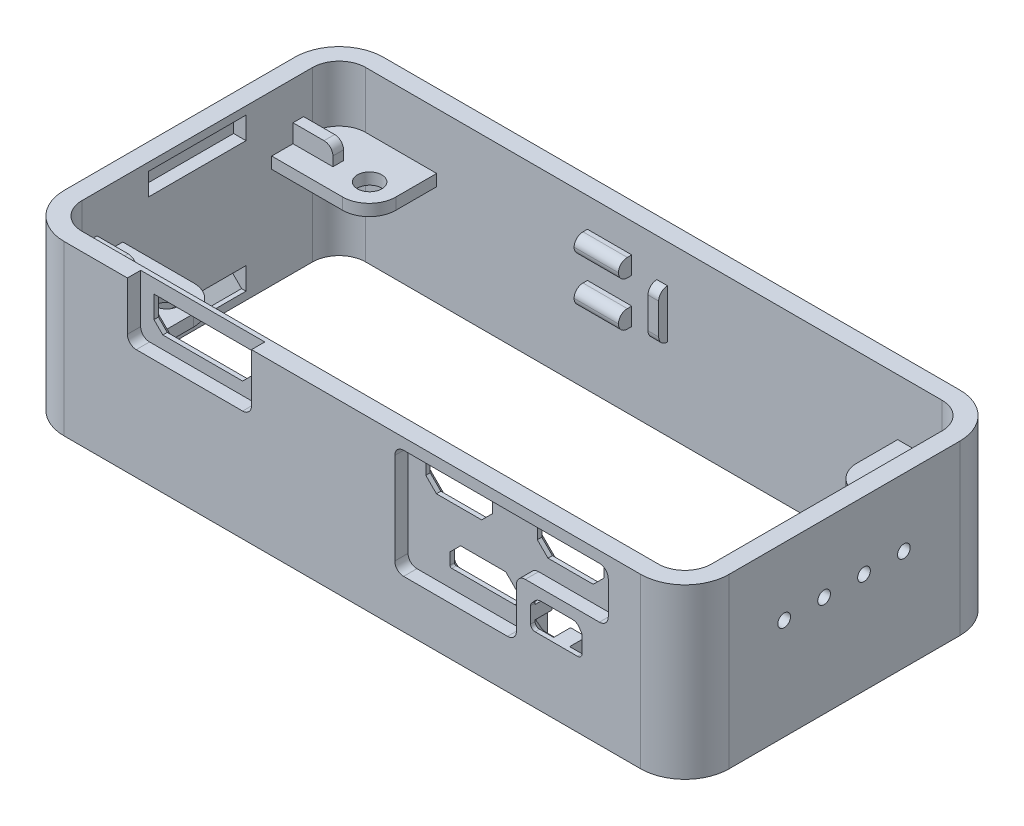
from build123d import *

# Parameters (mm, degrees)
EXTRUDE_1_DEPTH          = 7
EXTRUDE_1_DEPTH_BACK     = 12
CUT_EXTRUDE_2_DEPTH      = 45.635110658
CUT_EXTRUDE_2_DEPTH_BACK = 45.635110658
RIB_START                = -0.65
RIB_1_DEPTH              = 1.3
RIB_2_DEPTH              = 1.3
RIB_3_DEPTH              = 1.3
RIB_4_DEPTH              = 1.3
CUT_EXTRUDE_5_DEPTH      = 40
CUT_EXTRUDE_5_DEPTH_BACK = 40
SKETCH_18_R              = 1.375
SKETCH_41_W              = 14
SKETCH_41_H              = 6.5
CUT_EXTRUDE_14_DEPTH     = 1.5
EXTRUDE_14_DEPTH         = 0.5
CUT_EXTRUDE_18_DEPTH     = 1.5
SKETCH_50_W              = 7.5
SKETCH_50_H              = 2.7
CUT_EXTRUDE_19_DEPTH     = 2.9
SKETCH_51_W              = 5.8
SKETCH_51_H              = 2.8
CUT_EXTRUDE_20_DEPTH     = 2.4
FILLET_15_R              = 1
FILLET_16_R              = 1
FILLET_17_R              = 0.5
SKETCH_52_R              = 0.717792346
CUT_EXTRUDE_21_DEPTH     = 2
SKETCH_53_W              = 1.2
SKETCH_53_H              = 5.5
EXTRUDE_15_DEPTH         = 1
FILLET_20_R              = 1
SKETCH_55_W              = 1.2
SKETCH_55_H              = 5.5
EXTRUDE_17_DEPTH         = 1.4
SKETCH_54_W              = 1.2
SKETCH_54_H              = 5.5
EXTRUDE_18_DEPTH         = 4.5
FILLET_22_R              = 1
CHAMFER_2_SIZE           = 1.2
FILLET_23_R              = 0.2
SKETCH_58_W              = 11
SKETCH_58_H              = 2.5
CUT_EXTRUDE_23_DEPTH     = 1.4
CHAMFER_4_SIZE           = 1
SKETCH_59_W              = 11
SKETCH_59_H              = 2.5
CUT_EXTRUDE_24_DEPTH     = 1.4
CHAMFER_5_SIZE           = 1
SKETCH_60_W              = 7.5
SKETCH_60_H              = 5
CUT_EXTRUDE_25_DEPTH     = 0.5
EXTRUDE_20_DEPTH         = 0.9
EXTRUDE_20_DEPTH_BACK    = 0.5
SKETCH_56_W              = 0.6
SKETCH_56_H              = 1.5
SKETCH_56_W_2            = 1.8
SKETCH_56_H_2            = 0.767886541
SKETCH_56_W_3            = 1.5
SKETCH_56_H_3            = 1.54
CHAMFER_8_SIZE           = 1
SKETCH_63_W              = 1.2
SKETCH_63_H              = 5.5
EXTRUDE_21_DEPTH         = 4.5
FILLET_27_R              = 1
SKETCH_64_W              = 1.2
SKETCH_64_H              = 5.5
EXTRUDE_22_DEPTH         = 1.4
FILLET_28_R              = 1
SKETCH_65_W              = 1.2
SKETCH_65_H              = 5.5
EXTRUDE_23_DEPTH         = 0.9
CHAMFER_9_SIZE           = 0.5
FILLET_29_R              = 1
SKETCH_66_W              = 15
SKETCH_66_H              = 5
CUT_EXTRUDE_26_DEPTH     = 1.5
CHAMFER_10_SIZE          = 1
SKETCH_67_W              = 11
SKETCH_67_H              = 2.5
CUT_EXTRUDE_27_DEPTH     = 1.5
CHAMFER_11_SIZE          = 1
SKETCH_70_W              = 5
SKETCH_70_H              = 1.2
EXTRUDE_24_DEPTH         = 1.5
FILLET_31_R              = 1
SKETCH_71_W              = 5
SKETCH_71_H              = 2
EXTRUDE_25_DEPTH         = 1.5
FILLET_32_R              = 1
SKETCH_42_W              = 11
SKETCH_42_H              = 3.5
CUT_EXTRUDE_15_DEPTH     = 2.4
CUT_EXTRUDE_16_DEPTH     = 2.4
FILLET_33_R              = 1
SKETCH_74_W              = 16
SKETCH_74_H              = 7.4
EXTRUDE_26_DEPTH         = 0.5
CUT_EXTRUDE_29_REACH     = 56.445
SKETCH_46_W              = 11
SKETCH_46_H              = 3.5
CHAMFER_13_SIZE          = 1
FILLET_34_R              = 1
CHAMFER_14_SIZE          = 0.5
SKETCH_76_W              = 65
SKETCH_76_H              = 0.5
CUT_EXTRUDE_30_DEPTH     = 1.1
FILLET_35_R              = 1
FILLET_38_R              = 1.5


# Read off the part's stored shape, not the designer's step: 筋1, 筋2, 筋3, 筋4
# Some blends are built 0.0001 mm under size
with BuildPart() as part:
    # case 2 → 凸台-拉伸1 (new, two sides: drawn at the far end of the back side and taken through both)
    with BuildSketch(Plane(origin=(0, 0, 0), x_dir=(1, 0, 0), z_dir=(0, 1, 0)).offset(-EXTRUDE_1_DEPTH_BACK)):
        with BuildLine():
            Line((-34.042196447, 18), (30.957803553, 18))
            ThreePointArc((30.957803553, 18), (34.493337459, 16.535533906), (35.957803553, 13))
            Line((35.957803553, 13), (35.957803553, -13))
            ThreePointArc((35.957803553, -13), (34.493337459, -16.535533906), (30.957803553, -18))
            Line((30.957803553, -18), (-34.042196447, -18))
            ThreePointArc((-34.042196447, -18), (-37.577730353, -16.535533906), (-39.042196447, -13))
            Line((-39.042196447, -13), (-39.042196447, 13))
            ThreePointArc((-39.042196447, 13), (-37.577730353, 16.535533906), (-34.042196447, 18))
        make_face()
    extrude(amount=EXTRUDE_1_DEPTH + EXTRUDE_1_DEPTH_BACK)

    # 草图13 → 切除-拉伸2 (cut, two sides: drawn at the far end of the back side and taken through both)
    with BuildSketch(Plane(origin=(0, 0, 0), x_dir=(1, 0, 0), z_dir=(0, 1, 0)).offset(-CUT_EXTRUDE_2_DEPTH_BACK)):
        with BuildLine():
            Line((-34.042196447, -16), (30.957803553, -16))
            ThreePointArc((30.957803553, -16), (33.079123896, -15.121320344), (33.957803553, -13))
            Line((33.957803553, -13), (33.957803553, 13))
            ThreePointArc((33.957803553, 13), (33.079123896, 15.121320344), (30.957803553, 16))
            Line((30.957803553, 16), (-34.042196447, 16))
            ThreePointArc((-34.042196447, 16), (-36.163516791, 15.121320344), (-37.042196447, 13))
            Line((-37.042196447, 13), (-37.042196447, -13))
            ThreePointArc((-37.042196447, -13), (-36.163516791, -15.121320344), (-34.042196447, -16))
        make_face()
    extrude(amount=CUT_EXTRUDE_2_DEPTH + CUT_EXTRUDE_2_DEPTH_BACK, mode=Mode.SUBTRACT)

    # 筋1 outline → 筋1 (add)
    with BuildSketch(Plane(origin=(0, 0, 0), x_dir=(1, 0, 0), z_dir=(0, 1, 0)).offset(RIB_START)):
        with BuildLine():
            Line((-37.042196447, 8.4), (-29.042196447, 8.4))
            ThreePointArc((-29.042196447, 8.4), (-26.920876103, 9.278679657), (-26.042196447, 11.4))
            Line((-26.042196447, 11.4), (-26.042196447, 16))
            Line((-26.042196447, 16), (-34.042196447, 16))
            ThreePointArc((-34.042196447, 16), (-36.163516791, 15.121320344), (-37.042196447, 13))
            Line((-37.042196447, 13), (-37.042196447, 8.4))
        make_face()
    extrude(amount=RIB_1_DEPTH)

    # 筋2 outline → 筋2 (add)
    with BuildSketch(Plane(origin=(0, 0, 0), x_dir=(1, 0, 0), z_dir=(0, 1, 0)).offset(RIB_START)):
        with BuildLine():
            Line((-34.042196447, -16), (-26.042196447, -16))
            Line((-26.042196447, -16), (-26.042196447, -11.4))
            ThreePointArc((-26.042196447, -11.4), (-26.920876103, -9.278679657), (-29.042196447, -8.4))
            Line((-29.042196447, -8.4), (-37.042196447, -8.4))
            Line((-37.042196447, -8.4), (-37.042196447, -13))
            ThreePointArc((-37.042196447, -13), (-36.163516791, -15.121320344), (-34.042196447, -16))
        make_face()
    extrude(amount=RIB_2_DEPTH)

    # 筋3 outline → 筋3 (add)
    with BuildSketch(Plane(origin=(0, 0, 0), x_dir=(1, 0, 0), z_dir=(0, 1, 0)).offset(RIB_START)):
        with BuildLine():
            ThreePointArc((25.957803553, 11.4), (26.836483209, 9.278679656), (28.957803553, 8.4))
            Line((28.957803553, 8.4), (33.957803553, 8.4))
            Line((33.957803553, 8.4), (33.957803553, 13))
            ThreePointArc((33.957803553, 13), (33.079123897, 15.121320343), (30.957803553, 16))
            Line((30.957803553, 16), (25.957803553, 16))
            Line((25.957803553, 16), (25.957803553, 11.4))
        make_face()
    extrude(amount=RIB_3_DEPTH)

    # 筋4 outline → 筋4 (add)
    with BuildSketch(Plane(origin=(0, 0, 0), x_dir=(1, 0, 0), z_dir=(0, 1, 0)).offset(RIB_START)):
        with BuildLine():
            Line((33.957803553, -13), (33.957803553, -8.4))
            Line((33.957803553, -8.4), (28.957803553, -8.4))
            ThreePointArc((28.957803553, -8.4), (26.836483209, -9.278679656), (25.957803553, -11.4))
            Line((25.957803553, -11.4), (25.957803553, -16))
            Line((25.957803553, -16), (30.957803553, -16))
            ThreePointArc((30.957803553, -16), (33.079123897, -15.121320343), (33.957803553, -13))
        make_face()
    extrude(amount=RIB_4_DEPTH)

    # 草图18 → 切除-拉伸5 (cut, two sides: drawn at the far end of the back side and taken through both)
    with BuildSketch(Plane(origin=(0, 0, 0), x_dir=(1, 0, 0), z_dir=(0, 1, 0)).offset(-CUT_EXTRUDE_5_DEPTH_BACK)):
        with Locations(Location((-29, 11.4, 0), (0, 0, 270))):
            Circle(SKETCH_18_R)
        with Locations(Location((-29, -11.5, 0), (0, 0, 270))):
            Circle(SKETCH_18_R)
        with Locations(Location((29, 11.4, 0), (0, 0, 270))):
            Circle(SKETCH_18_R)
        with Locations(Location((29, -11.5, 0), (0, 0, 270))):
            Circle(SKETCH_18_R)
    extrude(amount=CUT_EXTRUDE_5_DEPTH + CUT_EXTRUDE_5_DEPTH_BACK, mode=Mode.SUBTRACT)

    # 草图41 → 切除-拉伸14 (cut)
    with BuildSketch(Plane.XY.offset(18)):
        with Locations((-19.922149827, 3.75)):
            Rectangle(SKETCH_41_W, SKETCH_41_H)
    extrude(amount=-CUT_EXTRUDE_14_DEPTH, mode=Mode.SUBTRACT)

    # 草图48 → 凸台-拉伸14 (add)
    with BuildSketch(Plane(origin=(0, 0, 16), x_dir=(-1, 0, 0), z_dir=(0, 0, -1))):
        Polygon((-2.234862183, -7.567886541), (-2.234862183, 6.748192542), (-28.313738428, 6.748192542), (-28.313738428, -1), (-17.957803553, -1), (-17.957803553, -7.567886541), align=None)
    extrude(amount=EXTRUDE_14_DEPTH)

    # 草图49 → 切除-拉伸18 (cut)
    with BuildSketch(Plane.XY.offset(18)):
        Polygon((27.313738428, 5.748192542), (27.313738428, 0), (16.957803553, 0), (16.957803553, -6.567886541), (3.234862183, -6.567886541), (3.234862183, 5.748192542), align=None)
    extrude(amount=-CUT_EXTRUDE_18_DEPTH, mode=Mode.SUBTRACT)

    # 草图50 → 切除-拉伸19 (cut)
    with BuildSketch(Plane.XY.offset(18)):
        with Locations((21.563738428, 3.198192542)):
            Rectangle(SKETCH_50_W, SKETCH_50_H)
        with Locations((11.707803553, -3.217886541)):
            Rectangle(SKETCH_50_W, SKETCH_50_H)
        with Locations((8.984862183, 3.198192542)):
            Rectangle(SKETCH_50_W, SKETCH_50_H)
    extrude(amount=-CUT_EXTRUDE_19_DEPTH, mode=Mode.SUBTRACT)

    # 草图51 → 切除-拉伸20 (cut)
    with BuildSketch(Plane.XY.offset(18)):
        with Locations((21.457803553, -3.167886541)):
            Rectangle(SKETCH_51_W, SKETCH_51_H)
    extrude(amount=-CUT_EXTRUDE_20_DEPTH, mode=Mode.SUBTRACT)

    # 圆角15
    fillet_15_edges = [part.edges().sort_by_distance(p)[0] for p in [
        (3.234862183, 5.748192542, 17.25),
        (27.313738428, 5.748192542, 17.25),
        (27.313738428, 0, 17.25),
        (16.957803553, 0, 17.25),
        (16.957803553, -6.567886541, 17.25),
        (3.234862183, -6.567886541, 17.25),
    ]]
    fillet(fillet_15_edges, radius=FILLET_15_R)

    # 圆角16
    # the kernel refuses this fillet: 1 mm, written as the material it takes off along each edge
    with BuildSketch(Plane(origin=(2.234862183, -7.567886541, 16), x_dir=(0, 1, 0), z_dir=(0, 0, -1)), Plane(origin=(17.957803553, -7.567886541, 16), x_dir=(-1, 0, 0), z_dir=(0, 0, -1))) as fillet_16_piece_1:
        with BuildLine():
            CenterArc((FILLET_16_R, FILLET_16_R), FILLET_16_R, 180, 90)
            Line((0, FILLET_16_R), (-FILLET_16_R * 0.02, FILLET_16_R))
            Line((-FILLET_16_R * 0.02, FILLET_16_R), (-FILLET_16_R * 0.02, -FILLET_16_R * 0.02))
            Line((-FILLET_16_R * 0.02, -FILLET_16_R * 0.02), (FILLET_16_R, -FILLET_16_R * 0.02))
            Line((FILLET_16_R, -FILLET_16_R * 0.02), (FILLET_16_R, 0))
        make_face()
    extrude(amount=3, mode=Mode.SUBTRACT)
    with BuildSketch(Plane(origin=(28.313738428, -1, 16), x_dir=(0, 1, 0), z_dir=(0, 0, -1))) as fillet_16_piece_2:
        with BuildLine():
            CenterArc((1, -0.759934208), FILLET_16_R, 130.541601874, 49.458398126)
            Line((0, -0.759934208), (-0.02, -0.759934208))
            Line((-0.02, -0.759934208), (-0.02, 0))
            Line((-0.02, 0), (0, 0.02))
            ThreePointArc((0, 0.02), (0.175, 0.02), (0.337, 0.015198684))
            Line((0.337, 0.015198684), (0.35, 0))
        make_face()
    extrude(amount=2.399835519, mode=Mode.SUBTRACT)

    # 圆角17
    fillet_17_edges = [part.edges().sort_by_distance(p)[0] for p in [
        (18.557803553, -1.767886541, 17),
        (24.357803553, -1.767886541, 17),
        (24.357803553, -4.567886541, 17),
        (18.557803553, -4.567886541, 17),
    ]]
    fillet(fillet_17_edges, radius=FILLET_17_R)

    # 草图52 → 切除-拉伸21 (cut)
    with BuildSketch(Plane(origin=(35.957803553, 0, 0), x_dir=(0, 0, -1), z_dir=(1, 0, 0))):
        with Locations((-6.8, -0.597891307)):
            Circle(SKETCH_52_R)
        with Locations((-2.3, -0.597891307)):
            Circle(SKETCH_52_R)
        with Locations((2.2, -0.597891307)):
            Circle(SKETCH_52_R)
        with Locations((6.7, -0.597891307)):
            Circle(SKETCH_52_R)
    extrude(amount=-CUT_EXTRUDE_21_DEPTH, mode=Mode.SUBTRACT)

    # 草图53 → 凸台-拉伸15 (add)
    with BuildSketch(Plane.XY.offset(-16)):
        with Locations((-0.6, -0.05)):
            Rectangle(SKETCH_53_W, SKETCH_53_H)
    extrude(amount=EXTRUDE_15_DEPTH)

    # 圆角20
    fillet_20_edges = [part.edges().sort_by_distance(p)[0] for p in [
        (-0.6, -2.8, -15),
        (-0.6, 2.7, -15),
    ]]
    fillet(fillet_20_edges, radius=FILLET_20_R - 0.0001)  # a hair under: the kernel refuses the full size

    # 草图55 → 凸台-拉伸17 (add)
    with BuildSketch(Plane.ZY.offset(-33.957803553)):
        with Locations((-11.4, -0.05)):
            Rectangle(SKETCH_55_W, SKETCH_55_H)
    extrude(amount=EXTRUDE_17_DEPTH)

    # 草图54 → 凸台-拉伸18 (add)
    with BuildSketch(Plane(origin=(-37.042196447, 0, 0), x_dir=(0, 0, -1), z_dir=(1, 0, 0))):
        with Locations((11.4, -0.05)):
            Rectangle(SKETCH_54_W, SKETCH_54_H)
    extrude(amount=EXTRUDE_18_DEPTH)

    # 圆角22
    fillet_22_edges = [part.edges().sort_by_distance(p)[0] for p in [
        (32.557803553, -2.8, -11.4),
        (32.557803553, 2.7, -11.4),
        (-32.542196447, -2.8, -11.4),
        (-32.542196447, 2.7, -11.4),
    ]]
    fillet(fillet_22_edges, radius=FILLET_22_R)

    # 倒角2
    chamfer_2_edges = [part.edges().sort_by_distance(p)[0] for p in [
        (25.313738428, 1.848192542, 16),
        (17.813738428, 1.848192542, 16),
        (7.957803553, -1.867886541, 16),
        (15.457803553, -1.867886541, 16),
        (5.234862183, 1.848192542, 16),
        (12.734862183, 1.848192542, 16),
    ]]
    chamfer(chamfer_2_edges, length=CHAMFER_2_SIZE)

    # 圆角23
    fillet_23_edges = [part.edges().sort_by_distance(p)[0] for p in [
        (17.813738428, 4.548192542, 16),
        (25.313738428, 4.548192542, 16),
        (15.457803553, -4.567886541, 16),
        (7.957803553, -4.567886541, 16),
        (5.234862183, 4.548192542, 16),
        (12.734862183, 4.548192542, 16),
    ]]
    fillet(fillet_23_edges, radius=FILLET_23_R)

    # 草图58 → 切除-拉伸23 (cut)
    with BuildSketch(Plane.ZY.offset(-33.957803553)):
        with Locations((0, -9.85)):
            Rectangle(SKETCH_58_W, SKETCH_58_H)
    extrude(amount=-CUT_EXTRUDE_23_DEPTH, mode=Mode.SUBTRACT)

    # 倒角4
    chamfer_4_edges = [part.edges().sort_by_distance(p)[0] for p in [
        (35.357803553, -11.1, 0),
    ]]
    chamfer(chamfer_4_edges, length=CHAMFER_4_SIZE)

    # 草图59 → 切除-拉伸24 (cut)
    with BuildSketch(Plane(origin=(-37.042196447, 0, 0), x_dir=(0, 0, -1), z_dir=(1, 0, 0))):
        with Locations((0, 4.85)):
            Rectangle(SKETCH_59_W, SKETCH_59_H)
    extrude(amount=-CUT_EXTRUDE_24_DEPTH, mode=Mode.SUBTRACT)

    # 倒角5
    chamfer_5_edges = [part.edges().sort_by_distance(p)[0] for p in [
        (-38.442196447, 6.1, 0),
    ]]
    chamfer(chamfer_5_edges, length=CHAMFER_5_SIZE)

    # 草图60 → 切除-拉伸25 (cut)
    with BuildSketch(Plane(origin=(0, 0, 16), x_dir=(-1, 0, 0), z_dir=(0, 0, -1))):
        with Locations((-21.707803553, -3.5)):
            Rectangle(SKETCH_60_W, SKETCH_60_H)
    extrude(amount=-CUT_EXTRUDE_25_DEPTH, mode=Mode.SUBTRACT)

    # 草图56 → 凸台-拉伸20 (add, two sides: drawn at the far end of the back side and taken through both)
    with BuildSketch(Plane(origin=(0, 0, 16), x_dir=(-1, 0, 0), z_dir=(0, 0, -1)).offset(-EXTRUDE_20_DEPTH_BACK)):
        with Locations((-18.257803553, -3.15173139)):
            Rectangle(SKETCH_56_W, SKETCH_56_H)
        with Locations((-21.557803553, -1.383943271)):
            Rectangle(SKETCH_56_W_2, SKETCH_56_H_2)
        with Locations((-25.107803553, -3.15173139)):
            Rectangle(SKETCH_56_W_3, SKETCH_56_H)
        with Locations((-21.557803553, -5.337886541)):
            Rectangle(SKETCH_56_W_2, SKETCH_56_H_3)
    extrude(amount=EXTRUDE_20_DEPTH + EXTRUDE_20_DEPTH_BACK)

    # 倒角8
    # the kernel refuses this chamfer: 1 mm, written as the material it takes off along each edge
    with BuildSketch(Plane(origin=(19.057803553, -2.267886541, 16.5), x_dir=(-1, 0, 0), z_dir=(0, -1, 0))) as chamfer_8_piece_1_section:
        Polygon((0.5, -CHAMFER_8_SIZE), (0.5 + CHAMFER_8_SIZE, 0), (0.5, 0), align=None)
    chamfer_8_piece_1 = revolve(axis=Axis((19.057803553, -2.267886541, 16.5), (0, 0, -1)), revolution_arc=90, mode=Mode.PRIVATE)
    chamfer_8_piece_1 = split(chamfer_8_piece_1, bisect_by=Plane(origin=(17.957803553, -1.691525434, 16.812800838), z_dir=(1, 0, 0)), keep=Keep.TOP, mode=Mode.PRIVATE)
    chamfer_8_piece_1 = split(chamfer_8_piece_1, bisect_by=Plane(origin=(18.527910829, -1, 16.812800838), z_dir=(0, -1, 0)), keep=Keep.TOP, mode=Mode.PRIVATE)
    add(chamfer_8_piece_1, mode=Mode.SUBTRACT)
    with BuildSketch(Plane(origin=(24.357803553, -2.267886541, 16.5), x_dir=(-0.027495876610585647, 0, 0.9996219169112968), z_dir=(0, -1, 0))) as chamfer_8_piece_2:
        Polygon((CHAMFER_8_SIZE * 0.999621916911, -CHAMFER_8_SIZE * 0.0274958766106), (-CHAMFER_8_SIZE * 0.0274958766106, -CHAMFER_8_SIZE * 0.999621916911), (0, 0), align=None)
    extrude(amount=0.133844849, mode=Mode.SUBTRACT)
    with BuildSketch(Plane(origin=(23.857803553, -4.067886541, 16.5), x_dir=(1, 0, 0), z_dir=(0, 1, 0))) as chamfer_8_piece_3:
        Polygon((0.5, -CHAMFER_8_SIZE), (0.5 + CHAMFER_8_SIZE, 0), (0.5, 0), align=None)
    revolve(axis=Axis((23.857803553, -4.067886541, 16.5), (0, 0, -1)), revolution_arc=90, mode=Mode.SUBTRACT)
    with BuildSketch(Plane(origin=(23.857803553, -4.567886541, 16.5), x_dir=(0, 0.02749587661058651, 0.9996219169112968), z_dir=(-1, 0, 0))) as chamfer_8_piece_4:
        Polygon((CHAMFER_8_SIZE * 0.999621916911, -CHAMFER_8_SIZE * 0.0274958766106), (-CHAMFER_8_SIZE * 0.0274958766106, -CHAMFER_8_SIZE * 0.999621916911), (0, 0), align=None)
    extrude(amount=1.4, mode=Mode.SUBTRACT)
    with BuildSketch(Plane(origin=(23.857803553, -4.567886541, 16.5), x_dir=(0, 0.02749587661058651, 0.9996219169112968), z_dir=(-1, 0, 0))) as chamfer_8_piece_5_section:
        Polygon((CHAMFER_8_SIZE * 0.999621916911, -CHAMFER_8_SIZE * 0.0274958766106), (-CHAMFER_8_SIZE * 0.0274958766106, -CHAMFER_8_SIZE * 0.999621916911), (0, 0), align=None)
    chamfer_8_piece_5 = extrude(amount=3.971682988, mode=Mode.PRIVATE)
    chamfer_8_piece_5 = split(chamfer_8_piece_5, bisect_by=Plane(origin=(20.657803553, -4.897680168, 16.829793627), z_dir=(-1, 0, 0)), keep=Keep.TOP, mode=Mode.PRIVATE)
    add(chamfer_8_piece_5, mode=Mode.SUBTRACT)
    with BuildSketch(Plane(origin=(19.057803553, -4.067886541, 16.5), x_dir=(0, -1, 0), z_dir=(1, 0, 0))) as chamfer_8_piece_6_section:
        Polygon((0.5, -CHAMFER_8_SIZE), (0.5 + CHAMFER_8_SIZE, 0), (0.5, 0), align=None)
    chamfer_8_piece_6 = revolve(axis=Axis((19.057803553, -4.067886541, 16.5), (0, 0, -1)), revolution_arc=90, mode=Mode.PRIVATE)
    chamfer_8_piece_6 = split(chamfer_8_piece_6, bisect_by=Plane(origin=(17.957803553, -4.664386094, 16.805594695), z_dir=(1, 0, 0)), keep=Keep.TOP, mode=Mode.PRIVATE)
    add(chamfer_8_piece_6, mode=Mode.SUBTRACT)
    with BuildSketch(Plane(origin=(18.557803553, -4.067886541, 16.5), x_dir=(0.027495876610585647, 0, 0.9996219169112968), z_dir=(0, 1, 0))) as chamfer_8_piece_7_section:
        Polygon((CHAMFER_8_SIZE * 0.999621916911, -CHAMFER_8_SIZE * 0.0274958766106), (-CHAMFER_8_SIZE * 0.0274958766106, -CHAMFER_8_SIZE * 0.999621916911), (0, 0), align=None)
    chamfer_8_piece_7 = extrude(amount=0.166155151, mode=Mode.PRIVATE)
    chamfer_8_piece_7 = split(chamfer_8_piece_7, bisect_by=Plane(origin=(17.957803553, -3.984808965, 16.87500946), z_dir=(1, 0, 0)), keep=Keep.TOP, mode=Mode.PRIVATE)
    add(chamfer_8_piece_7, mode=Mode.SUBTRACT)
    with BuildSketch(Plane(origin=(19.057803553, -1.767886541, 16.5), x_dir=(0, -0.02749587661058651, 0.9996219169112968), z_dir=(1, 0, 0))) as chamfer_8_piece_8_section:
        Polygon((CHAMFER_8_SIZE * 0.999621916911, -CHAMFER_8_SIZE * 0.0274958766106), (-CHAMFER_8_SIZE * 0.0274958766106, -CHAMFER_8_SIZE * 0.999621916911), (0, 0), align=None)
    chamfer_8_piece_8 = extrude(amount=1.6, mode=Mode.PRIVATE)
    chamfer_8_piece_8 = split(chamfer_8_piece_8, bisect_by=Plane(origin=(19.857803553, -1, 16.849634221), z_dir=(0, -1, 0)), keep=Keep.TOP, mode=Mode.PRIVATE)
    add(chamfer_8_piece_8, mode=Mode.SUBTRACT)
    with BuildSketch(Plane(origin=(19.057803553, -1.767886541, 16.5), x_dir=(0, -0.02749587661058651, 0.9996219169112968), z_dir=(1, 0, 0))) as chamfer_8_piece_9_section:
        Polygon((CHAMFER_8_SIZE * 0.999621916911, -CHAMFER_8_SIZE * 0.0274958766106), (-CHAMFER_8_SIZE * 0.0274958766106, -CHAMFER_8_SIZE * 0.999621916911), (0, 0), align=None)
    chamfer_8_piece_9 = extrude(amount=4.171682988, mode=Mode.PRIVATE)
    chamfer_8_piece_9 = split(chamfer_8_piece_9, bisect_by=Plane(origin=(22.843645047, -1, 16.849634221), z_dir=(0, -1, 0)), keep=Keep.TOP, mode=Mode.PRIVATE)
    chamfer_8_piece_9 = split(chamfer_8_piece_9, bisect_by=Plane(origin=(22.457803553, -1.47595166, 16.849634221), z_dir=(1, 0, 0)), keep=Keep.TOP, mode=Mode.PRIVATE)
    add(chamfer_8_piece_9, mode=Mode.SUBTRACT)
    with BuildSketch(Plane(origin=(23.857803553, -2.267886541, 16.5), x_dir=(0, 1, 0), z_dir=(-1, 0, 0))) as chamfer_8_piece_10_section:
        Polygon((0.5, -CHAMFER_8_SIZE), (0.5 + CHAMFER_8_SIZE, 0), (0.5, 0), align=None)
    chamfer_8_piece_10 = revolve(axis=Axis((23.857803553, -2.267886541, 16.5), (0, 0, -1)), revolution_arc=90, mode=Mode.PRIVATE)
    chamfer_8_piece_10 = split(chamfer_8_piece_10, bisect_by=Plane(origin=(24.442211252, -1, 16.795113349), z_dir=(0, -1, 0)), keep=Keep.TOP, mode=Mode.PRIVATE)
    add(chamfer_8_piece_10, mode=Mode.SUBTRACT)
    with BuildSketch(Plane(origin=(19.886120565, -1.767886541, 16.5), x_dir=(0, -0.027495876610586296, 0.9996219169112968), z_dir=(1, 0, 0))) as chamfer_8_piece_11_section:
        Polygon((CHAMFER_8_SIZE * 0.999621916911, -CHAMFER_8_SIZE * 0.0274958766106), (-CHAMFER_8_SIZE * 0.0274958766106, -CHAMFER_8_SIZE * 0.999621916911), (0, 0), align=None)
    chamfer_8_piece_11 = extrude(amount=3.971682988, mode=Mode.PRIVATE)
    chamfer_8_piece_11 = split(chamfer_8_piece_11, bisect_by=Plane(origin=(20.271962059, -1, 16.849634221), z_dir=(0, -1, 0)), keep=Keep.TOP, mode=Mode.PRIVATE)
    chamfer_8_piece_11 = split(chamfer_8_piece_11, bisect_by=Plane(origin=(20.657803553, -1.47595166, 16.849634221), z_dir=(-1, 0, 0)), keep=Keep.TOP, mode=Mode.PRIVATE)
    add(chamfer_8_piece_11, mode=Mode.SUBTRACT)
    with BuildSketch(Plane(origin=(22.457803553, -1.767886541, 16.5), x_dir=(0, -0.02749587661058651, 0.9996219169112968), z_dir=(1, 0, 0))) as chamfer_8_piece_12_section:
        Polygon((CHAMFER_8_SIZE * 0.999621916911, -CHAMFER_8_SIZE * 0.0274958766106), (-CHAMFER_8_SIZE * 0.0274958766106, -CHAMFER_8_SIZE * 0.999621916911), (0, 0), align=None)
    chamfer_8_piece_12 = extrude(amount=1.4, mode=Mode.PRIVATE)
    chamfer_8_piece_12 = split(chamfer_8_piece_12, bisect_by=Plane(origin=(23.157803553, -1, 16.849634221), z_dir=(0, -1, 0)), keep=Keep.TOP, mode=Mode.PRIVATE)
    add(chamfer_8_piece_12, mode=Mode.SUBTRACT)
    with BuildSketch(Plane(origin=(18.557803553, -2.40173139, 16.5), x_dir=(0.027495876610585647, 0, 0.9996219169112968), z_dir=(0, 1, 0))) as chamfer_8_piece_13_section:
        Polygon((CHAMFER_8_SIZE * 0.999621916911, -CHAMFER_8_SIZE * 0.0274958766106), (-CHAMFER_8_SIZE * 0.0274958766106, -CHAMFER_8_SIZE * 0.999621916911), (0, 0), align=None)
    chamfer_8_piece_13 = extrude(amount=0.133844849, mode=Mode.PRIVATE)
    chamfer_8_piece_13 = split(chamfer_8_piece_13, bisect_by=Plane(origin=(17.957803553, -2.334808965, 16.87500946), z_dir=(1, 0, 0)), keep=Keep.TOP, mode=Mode.PRIVATE)
    add(chamfer_8_piece_13, mode=Mode.SUBTRACT)
    with BuildSketch(Plane(origin=(24.357803553, -3.90173139, 16.5), x_dir=(-0.027495876610585647, 0, 0.9996219169112968), z_dir=(0, -1, 0))) as chamfer_8_piece_14:
        Polygon((CHAMFER_8_SIZE * 0.999621916911, -CHAMFER_8_SIZE * 0.0274958766106), (-CHAMFER_8_SIZE * 0.0274958766106, -CHAMFER_8_SIZE * 0.999621916911), (0, 0), align=None)
    extrude(amount=0.166155151, mode=Mode.SUBTRACT)
    with BuildSketch(Plane(origin=(23.229486541, -4.567886541, 16.5), x_dir=(0, 0.02749587661058651, 0.9996219169112968), z_dir=(-1, 0, 0))) as chamfer_8_piece_15_section:
        Polygon((CHAMFER_8_SIZE * 0.999621916911, -CHAMFER_8_SIZE * 0.0274958766106), (-CHAMFER_8_SIZE * 0.0274958766106, -CHAMFER_8_SIZE * 0.999621916911), (0, 0), align=None)
    chamfer_8_piece_15 = extrude(amount=4.171682988, mode=Mode.PRIVATE)
    chamfer_8_piece_15 = split(chamfer_8_piece_15, bisect_by=Plane(origin=(22.457803553, -4.897680168, 16.829793627), z_dir=(1, 0, 0)), keep=Keep.TOP, mode=Mode.PRIVATE)
    add(chamfer_8_piece_15, mode=Mode.SUBTRACT)
    with BuildSketch(Plane(origin=(20.657803553, -4.567886541, 16.5), x_dir=(0, 0.02749587661058651, 0.9996219169112968), z_dir=(-1, 0, 0))) as chamfer_8_piece_16:
        Polygon((CHAMFER_8_SIZE * 0.999621916911, -CHAMFER_8_SIZE * 0.0274958766106), (-CHAMFER_8_SIZE * 0.0274958766106, -CHAMFER_8_SIZE * 0.999621916911), (0, 0), align=None)
    extrude(amount=1.6, mode=Mode.SUBTRACT)

    # 草图63 → 凸台-拉伸21 (add)
    with BuildSketch(Plane(origin=(-37.042196447, 0, 0), x_dir=(0, 0, -1), z_dir=(1, 0, 0))):
        with Locations((-11.9, -0.05)):
            Rectangle(SKETCH_63_W, SKETCH_63_H)
    extrude(amount=EXTRUDE_21_DEPTH)

    # 圆角27
    fillet_27_edges = [part.edges().sort_by_distance(p)[0] for p in [
        (-32.542196447, -2.8, 11.9),
        (-32.542196447, 2.7, 11.9),
    ]]
    fillet(fillet_27_edges, radius=FILLET_27_R)

    # 草图64 → 凸台-拉伸22 (add)
    with BuildSketch(Plane.ZY.offset(-33.957803553)):
        with Locations((11.9, -0.05)):
            Rectangle(SKETCH_64_W, SKETCH_64_H)
    extrude(amount=EXTRUDE_22_DEPTH)

    # 圆角28
    fillet_28_edges = [part.edges().sort_by_distance(p)[0] for p in [
        (32.557803553, -2.8, 11.9),
        (32.557803553, 2.7, 11.9),
    ]]
    fillet(fillet_28_edges, radius=FILLET_28_R)

    # 草图65 → 凸台-拉伸23 (add)
    with BuildSketch(Plane(origin=(0, 0, 16), x_dir=(-1, 0, 0), z_dir=(0, 0, -1))):
        with Locations((0.6, -0.05)):
            Rectangle(SKETCH_65_W, SKETCH_65_H)
    extrude(amount=EXTRUDE_23_DEPTH)

    # 倒角9
    chamfer_9_edges = [part.edges().sort_by_distance(p)[0] for p in [
        (21.557803553, -1.767886541, 15.1),
        (18.557803553, -3.15173139, 15.1),
        (24.357803553, -3.15173139, 15.1),
        (21.557803553, -4.567886541, 15.1),
    ]]
    chamfer(chamfer_9_edges, length=CHAMFER_9_SIZE)

    # 圆角29
    # the kernel refuses this fillet: 1 mm, written as the material it takes off along each edge
    with BuildSketch(Plane(origin=(0, -2.8, 15.1), x_dir=(0, 0, 1), z_dir=(-1, 0, 0)), Plane(origin=(-3.687468593, 2.7, 15.1), x_dir=(0, 0, 1), z_dir=(1, 0, 0))) as fillet_29_piece_1:
        with BuildLine():
            CenterArc((1, 0.994987437), FILLET_29_R, 180, 84.260829523)
            Line((0, 0.994987437), (0, 0))
            Line((0, 0), (0.9, 0))
        make_face()
    extrude(amount=3.687468593, mode=Mode.SUBTRACT)

    # 草图66 → 切除-拉伸26 (cut)
    with BuildSketch(Plane.ZY.offset(-33.957803553)):
        with Locations((0, 3.6)):
            Rectangle(SKETCH_66_W, SKETCH_66_H)
    extrude(amount=-CUT_EXTRUDE_26_DEPTH, mode=Mode.SUBTRACT)

    # 倒角10
    chamfer_10_edges = [part.edges().sort_by_distance(p)[0] for p in [
        (35.457803553, 6.1, 0),
    ]]
    chamfer(chamfer_10_edges, length=CHAMFER_10_SIZE)

    # 草图67 → 切除-拉伸27 (cut)
    with BuildSketch(Plane(origin=(-37.042196447, 0, 0), x_dir=(0, 0, -1), z_dir=(1, 0, 0))):
        with Locations((0, -9.85)):
            Rectangle(SKETCH_67_W, SKETCH_67_H)
    extrude(amount=-CUT_EXTRUDE_27_DEPTH, mode=Mode.SUBTRACT)

    # 倒角11
    chamfer_11_edges = [part.edges().sort_by_distance(p)[0] for p in [
        (-38.542196447, -11.1, 0),
    ]]
    chamfer(chamfer_11_edges, length=CHAMFER_11_SIZE)

    # 草图70 → 凸台-拉伸24 (add)
    with BuildSketch(Plane(origin=(0, 0, 16), x_dir=(-1, 0, 0), z_dir=(0, 0, -1))):
        with Locations((6.542196447, 2.45)):
            Rectangle(SKETCH_70_W, SKETCH_70_H)
        with Locations((6.542196447, -2.45)):
            Rectangle(SKETCH_70_W, SKETCH_70_H)
    extrude(amount=EXTRUDE_24_DEPTH)

    # 圆角31
    fillet_31_edges = [part.edges().sort_by_distance(p)[0] for p in [
        (-6.542196447, 3.05, 14.5),
        (-6.542196447, -3.05, 14.5),
    ]]
    fillet(fillet_31_edges, radius=FILLET_31_R)

    # 草图71 → 凸台-拉伸25 (add)
    with BuildSketch(Plane.XY.offset(-16)):
        with Locations((-6.537335394, 2.7)):
            Rectangle(SKETCH_71_W, SKETCH_71_H)
        with Locations((-6.537335394, -2.3)):
            Rectangle(SKETCH_71_W, SKETCH_71_H)
    extrude(amount=EXTRUDE_25_DEPTH)

    # 圆角32
    fillet_32_edges = [part.edges().sort_by_distance(p)[0] for p in [
        (-6.537335394, -3.3, -14.5),
        (-6.537335394, -1.3, -14.5),
        (-6.537335394, 1.7, -14.5),
        (-6.537335394, 3.7, -14.5),
    ]]
    fillet(fillet_32_edges, radius=FILLET_32_R - 0.0001)  # a hair under: the kernel refuses the full size

    # 草图42 → 切除-拉伸15 (cut)
    with BuildSketch(Plane.XY.offset(18)):
        with Locations((-19.922149827, 3.68)):
            Rectangle(SKETCH_42_W, SKETCH_42_H)
    extrude(amount=-CUT_EXTRUDE_15_DEPTH, mode=Mode.SUBTRACT)

    # 草图45 → 切除-拉伸16 (cut)
    with BuildSketch(Plane.XY.offset(18)):
        with BuildLine():
            Line((23.25, -1.252356616), (19.75, -1.252356616))
            ThreePointArc((19.75, -1.252356616), (19.042893219, -1.545249835), (18.75, -2.252356616))
            Line((18.75, -2.252356616), (18.75, -3.452356616))
            ThreePointArc((18.75, -3.452356616), (19.042893219, -4.159463397), (19.75, -4.452356616))
            Line((19.75, -4.452356616), (23.25, -4.452356616))
            ThreePointArc((23.25, -4.452356616), (23.957106781, -4.159463397), (24.25, -3.452356616))
            Line((24.25, -3.452356616), (24.25, -2.252356616))
            ThreePointArc((24.25, -2.252356616), (23.957106781, -1.545249835), (23.25, -1.252356616))
        make_face()
    extrude(amount=-CUT_EXTRUDE_16_DEPTH, mode=Mode.SUBTRACT)

    # 圆角33
    fillet_33_edges = [part.edges().sort_by_distance(p)[0] for p in [
        (-26.922149827, 0.5, 17.25),
        (-12.922149827, 0.5, 17.25),
    ]]
    fillet(fillet_33_edges, radius=FILLET_33_R)

    # 草图74 → 凸台-拉伸26 (add)
    with BuildSketch(Plane(origin=(0, 0, 16), x_dir=(-1, 0, 0), z_dir=(0, 0, -1))):
        with Locations((20.042196447, 3.3)):
            Rectangle(SKETCH_74_W, SKETCH_74_H)
    extrude(amount=EXTRUDE_26_DEPTH)

    # 草图46 → 切除-拉伸29 (cut, up to next)
    with BuildSketch(Plane.XY.offset(18), mode=Mode.PRIVATE) as cut_extrude_29_sk1:
        with Locations((-19.922149827, 3.68)):
            Rectangle(SKETCH_46_W, SKETCH_46_H)
    cut_extrude_29_tool1 = extrude(cut_extrude_29_sk1.sketch, amount=-CUT_EXTRUDE_29_REACH, mode=Mode.PRIVATE) & part.part
    add(cut_extrude_29_tool1.solids().sort_by_distance((-19.92215, 3.68, 18))[0], mode=Mode.SUBTRACT)

    # 倒角13
    chamfer_13_edges = [part.edges().sort_by_distance(p)[0] for p in [
        (-25.422149827, 1.93, 16),
        (-14.422149827, 1.93, 16),
    ]]
    chamfer(chamfer_13_edges, length=CHAMFER_13_SIZE)

    # 圆角34
    fillet_34_edges = [part.edges().sort_by_distance(p)[0] for p in [
        (-12.042196447, -0.4, 15.75),
    ]]
    fillet(fillet_34_edges, radius=FILLET_34_R)

    # 倒角14
    chamfer_14_edges = [part.edges().sort_by_distance(p)[0] for p in [
        (-19.922149827, 5.43, 15.5),
        (-25.422149827, 4.18, 15.5),
        (-14.422149827, 4.18, 15.5),
        (-19.922149827, 1.93, 15.5),
        (-14.922149827, 2.43, 15.5),
        (-24.922149827, 2.43, 15.5),
        (11.707803553, -1.867886541, 15.5),
        (15.457803553, -3.717886541, 15.5),
        (8.984862183, 1.848192542, 15.5),
        (5.234862183, 3.698192542, 15.5),
        (21.563738428, 1.848192542, 15.5),
        (17.813738428, 3.698192542, 15.5),
        (14.857803553, -2.467886541, 15.5),
        (8.557803553, -2.467886541, 15.5),
        (5.834862183, 2.448192542, 15.5),
        (12.134862183, 2.448192542, 15.5),
        (24.713738428, 2.448192542, 15.5),
        (18.413738428, 2.448192542, 15.5),
        (8.984862183, 4.548192542, 15.5),
        (12.734862183, 3.698192542, 15.5),
        (21.563738428, 4.548192542, 15.5),
        (25.313738428, 3.698192542, 15.5),
        (11.707803553, -4.567886541, 15.5),
        (7.957803553, -3.717886541, 15.5),
        (5.293440827, 4.489613898, 15.5),
        (12.676283539, 4.489613898, 15.5),
        (17.872317072, 4.489613898, 15.5),
        (25.255159784, 4.489613898, 15.5),
        (15.399224909, -4.509307897, 15.5),
        (8.016382197, -4.509307897, 15.5),
    ]]
    chamfer(chamfer_14_edges, length=CHAMFER_14_SIZE)

    # 草图76 → 切除-拉伸30 (cut)
    with BuildSketch(Plane(origin=(0, 7, 0), x_dir=(1, 0, 0), z_dir=(0, 1, 0))):
        with Locations((-1.542196447, -15.75)):
            Rectangle(SKETCH_76_W, SKETCH_76_H)
    extrude(amount=-CUT_EXTRUDE_30_DEPTH, mode=Mode.SUBTRACT)

    # 圆角35
    fillet_35_edges = [part.edges().sort_by_distance(p)[0] for p in [
        (2.234862183, 5.9, 15.75),
        (28.313738428, 5.9, 15.75),
        (-12.042196447, 5.9, 15.75),
        (-28.042196447, 5.9, 15.75),
    ]]
    fillet(fillet_35_edges, radius=FILLET_35_R)

    # 圆角38
    fillet_38_edges = [part.edges().sort_by_distance(p)[0] for p in [
        (35.457803553, 3.1, 7.5),
        (35.457803553, 3.1, -7.5),
        (35.457803553, 1.1, 0),
    ]]
    fillet(fillet_38_edges, radius=FILLET_38_R - 0.0001)  # a hair under: the kernel refuses the full size


solid = part.part
